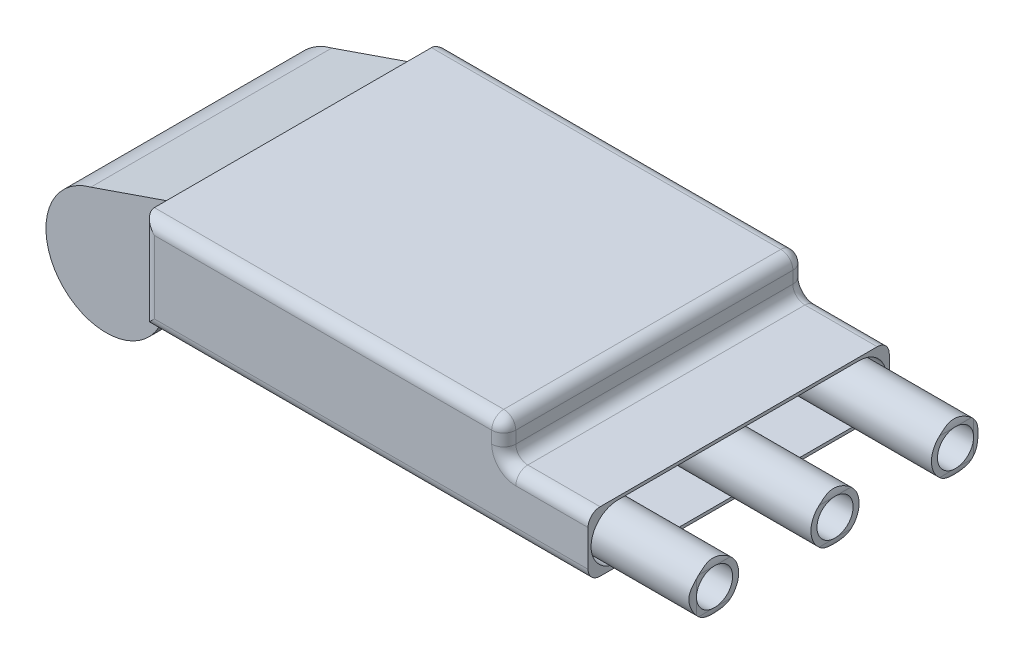
from build123d import *

# Parameters (mm, degrees)
IZIM1_W                     = 15
IZIM1_H                     = 25
Y_KSEKLIK_EKSTR_ZYON1_DEPTH = 5
IZIM2_W                     = 25
IZIM2_H                     = 8
Y_KSEKLIK_EKSTR_ZYON2_DEPTH = 30
Y_KSEKLIK_EKSTR_ZYON3_START = -2
Y_KSEKLIK_EKSTR_ZYON3_DEPTH = 20
Y_KSEKLIK_EKSTR_ZYON4_DEPTH = 20
RADYUS2_R                   = 1
IZIM8_R                     = 2
IZIM8_R_2                   = 1.5
KES_EKSTR_ZYON1_DEPTH       = 20
KES_EKSTR_ZYON2_DEPTH       = 8


with BuildPart() as part:
    # Çizim1 → Yükseklik-Ekstrüzyon1 (new body)
    with BuildSketch(Plane(origin=(0, 0, 0), x_dir=(1, 0, 0), z_dir=(0, 1, 0))):
        Rectangle(IZIM1_W, IZIM1_H)
    extrude(amount=Y_KSEKLIK_EKSTR_ZYON1_DEPTH)

    # Çizim2 → Yükseklik-Ekstrüzyon2 (add)
    with BuildSketch(Plane.ZY.offset(7.5)):
        with Locations((0, 4)):
            Rectangle(IZIM2_W, IZIM2_H)
    extrude(amount=Y_KSEKLIK_EKSTR_ZYON2_DEPTH)



with BuildPart() as body_2:
    # Çizim3 → Yükseklik-Ekstrüzyon3 (new body)
    with BuildSketch(Plane.XY.offset(12.5).offset(Y_KSEKLIK_EKSTR_ZYON3_START)):
        with BuildLine():
            ThreePointArc((-37.5, 1), (-38.964466094, 4.535533906), (-42.5, 6))
            ThreePointArc((-42.5, 6), (-46.035533906, -2.535533906), (-37.5, 1))
        make_face()
    extrude(amount=-Y_KSEKLIK_EKSTR_ZYON3_DEPTH)


with BuildPart() as part_1:
    add(part.part)

    add(body_2.part)  # Yükseklik-Ekstrüzyon4 merges body 2
    # Çizim6 → Yükseklik-Ekstrüzyon4 (add)
    with BuildSketch(Plane.XY.offset(10.5)):
        with BuildLine():
            Line((-37.5, 1), (-37.5, 8))
            Line((-37.5, 8), (-43.774516674, 5.834832701))
            ThreePointArc((-43.774516674, 5.834832701), (-39.448163125, 4.96059234), (-37.5, 1))
        make_face()
    extrude(amount=-Y_KSEKLIK_EKSTR_ZYON4_DEPTH)

    # Radyus2
    radyus2_edges = [part_1.edges().sort_by_distance(p)[0] for p in [
        (-7.5, 6.5, 12.5),
        (7.5, 2.5, -12.5),
        (-7.5, 6.5, -12.5),
        (-22.5, 8, -12.5),
        (-37.5, 4, -12.5),
        (-15, 0, -12.5),
        (0, 5, 12.5),
        (-7.5, 5, 0),
        (0, 5, -12.5),
        (7.5, 5, 0),
        (-37.5, 4, 12.5),
        (7.5, 0, 0),
        (-15, 0, 12.5),
        (-22.5, 8, 12.5),
        (-7.5, 8, 0),
        (7.5, 2.5, 12.5),
    ]]
    fillet(radyus2_edges, radius=RADYUS2_R)

    # Çizim8 → Kes-Ekstrüzyon1 (cut)
    # profile 1 of 4: a face of its own
    with BuildSketch(Plane(origin=(7.5, 0, 0), x_dir=(0, 0, -1), z_dir=(1, 0, 0))):
        with BuildLine():
            Line((10, 4.75), (-10, 4.75))
            ThreePointArc((-10, 4.75), (-12.25, 2.5), (-10, 0.25))
            Line((-10, 0.25), (10, 0.25))
            ThreePointArc((10, 0.25), (12.25, 2.5), (10, 4.75))
        make_face()
        with Locations((0, 2.5)):
            Circle(IZIM8_R, mode=Mode.SUBTRACT)
        with Locations((-10, 2.5)):
            Circle(IZIM8_R, mode=Mode.SUBTRACT)
        with Locations((10, 2.5)):
            Circle(IZIM8_R, mode=Mode.SUBTRACT)
    # profile 2 of 4: a face of its own
    with BuildSketch(Plane(origin=(7.5, 0, 0), x_dir=(0, 0, -1), z_dir=(1, 0, 0))):
        with Locations((0, 2.5)):
            Circle(IZIM8_R_2)
    # profile 3 of 4: a face of its own
    with BuildSketch(Plane(origin=(7.5, 0, 0), x_dir=(0, 0, -1), z_dir=(1, 0, 0))):
        with Locations((10, 2.5)):
            Circle(IZIM8_R_2)
    # profile 4 of 4: a face of its own
    with BuildSketch(Plane(origin=(7.5, 0, 0), x_dir=(0, 0, -1), z_dir=(1, 0, 0))):
        with Locations((-10, 2.5)):
            Circle(IZIM8_R_2)
    extrude(amount=-KES_EKSTR_ZYON1_DEPTH, mode=Mode.SUBTRACT)

    # Çizim9 → Kes-Ekstrüzyon2 (cut)
    with BuildSketch(Plane(origin=(7.5, 0, 0), x_dir=(0, 0, -1), z_dir=(1, 0, 0))):
        with BuildLine():
            Line((-10, 6.180321513), (10, 6.180321513))
            ThreePointArc((10, 6.180321513), (13.680321513, 2.5), (10, -1.180321513))
            Line((10, -1.180321513), (-10, -1.180321513))
            ThreePointArc((-10, -1.180321513), (-13.680321513, 2.5), (-10, 6.180321513))
        make_face()
        with BuildLine():
            Line((-10, 4.62230967), (10, 4.62230967))
            ThreePointArc((10, 4.62230967), (12.12230967, 2.5), (10, 0.37769033))
            Line((10, 0.37769033), (-10, 0.37769033))
            ThreePointArc((-10, 0.37769033), (-12.12230967, 2.5), (-10, 4.62230967))
        make_face(mode=Mode.SUBTRACT)
    extrude(amount=-KES_EKSTR_ZYON2_DEPTH, mode=Mode.SUBTRACT)


solid = part_1.part
